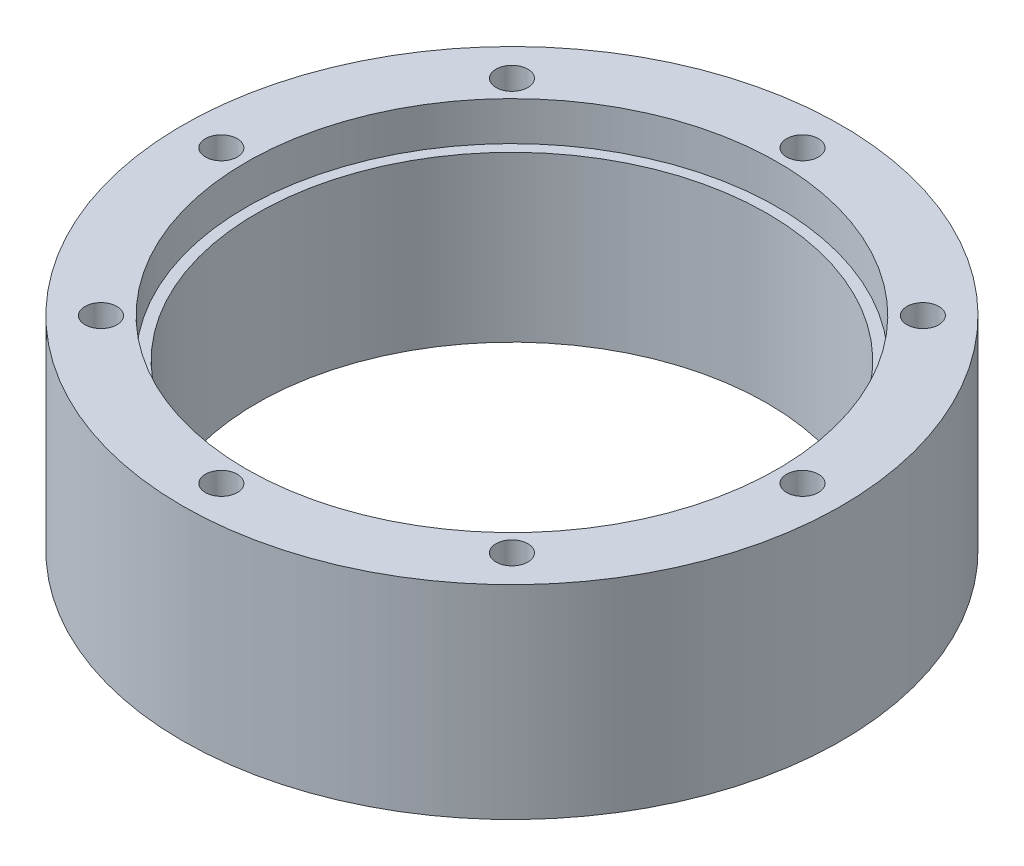
from build123d import *

# Parameters (mm, degrees)
SKETCH1_R           = 46.5
SKETCH1_R_2         = 36
BOSS_EXTRUDE1_DEPTH = 28.7
SKETCH2_R           = 2.25
CUT_EXTRUDE1_DEPTH  = 72.750888496
CUT_EXTRUDE2_START  = -5.5
SKETCH3_R           = 37.5
SKETCH3_R_2         = 36
CUT_EXTRUDE2_DEPTH  = 5.5


with BuildPart() as part:
    # Sketch1 → Boss-Extrude1 (new body)
    with BuildSketch(Plane(origin=(0, 0, 0), x_dir=(1, 0, 0), z_dir=(0, 1, 0))):
        Circle(SKETCH1_R)
        Circle(SKETCH1_R_2, mode=Mode.SUBTRACT)
    extrude(amount=BOSS_EXTRUDE1_DEPTH)

    # Sketch2 → Cut-Extrude1 (cut, through all)
    with BuildSketch(Plane(origin=(0, 28.7, 0), x_dir=(1, 0, 0), z_dir=(0, 1, 0))):
        with Locations((0, 41)):
            Circle(SKETCH2_R)
        with Locations((28.991378029, 28.991378029)):
            Circle(SKETCH2_R)
        with Locations((41, 0)):
            Circle(SKETCH2_R)
        with Locations((28.991378029, -28.991378029)):
            Circle(SKETCH2_R)
        with Locations((0, -41)):
            Circle(SKETCH2_R)
        with Locations((-28.991378029, -28.991378029)):
            Circle(SKETCH2_R)
        with Locations((-41, 0)):
            Circle(SKETCH2_R)
        with Locations((-28.991378029, 28.991378029)):
            Circle(SKETCH2_R)
    extrude(amount=-CUT_EXTRUDE1_DEPTH, mode=Mode.SUBTRACT)

    # Sketch3 → Cut-Extrude2 (cut)
    with BuildSketch(Plane(origin=(0, 28.7, 0), x_dir=(1, 0, 0), z_dir=(0, 1, 0)).offset(CUT_EXTRUDE2_START)):
        Circle(SKETCH3_R)
        Circle(SKETCH3_R_2, mode=Mode.SUBTRACT)
    extrude(amount=CUT_EXTRUDE2_DEPTH, mode=Mode.SUBTRACT)


solid = part.part
